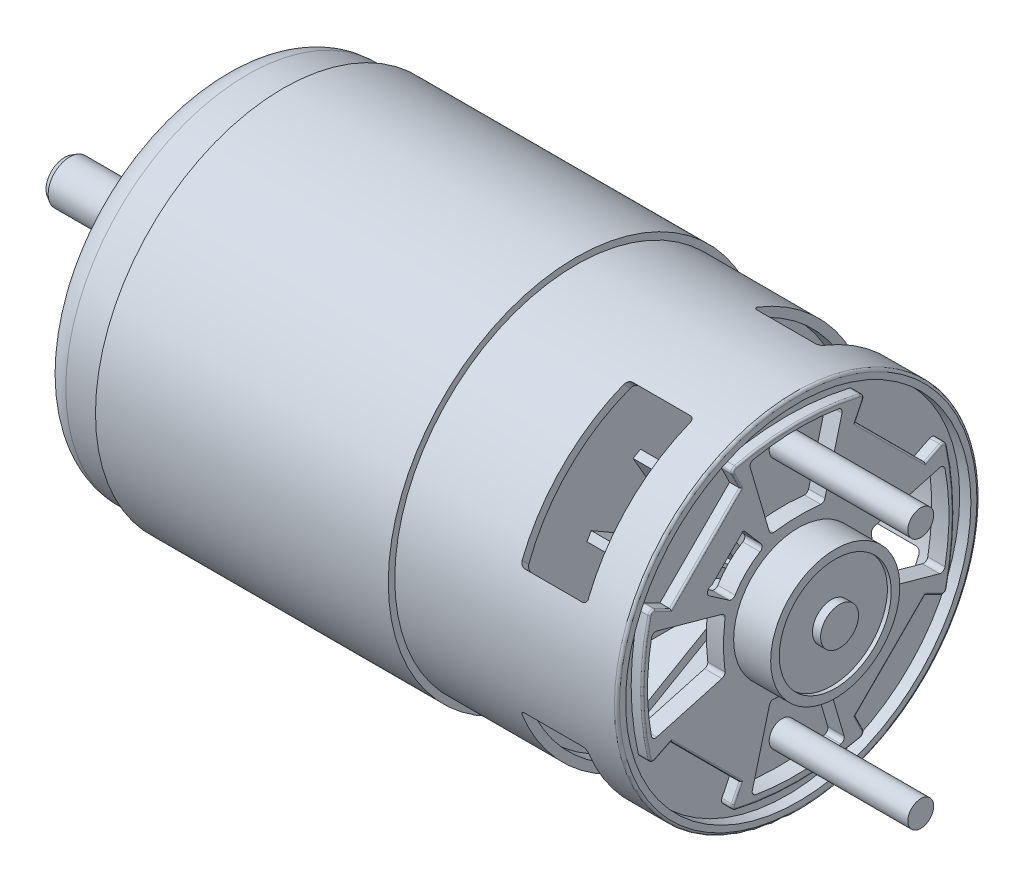
from build123d import *
from build123d.topology import SkipClean

# Parameters (mm, degrees)
CORTE_EXTRUS_O1_DEPTH                         = 89.581936213
CIRPATTERN1_COUNT                             = 3
CIRPATTERN1_ANGLE                             = 180
ESBO_O7_R                                     = 20.05
CORTE_EXTRUS_O3_DEPTH                         = 1.3
CORTE_EXTRUS_O5_DEPTH                         = 10
FILETE8_R                                     = 0.2
FILETE15_R                                    = 0.3
CORTE_EXTRUS_O8_START                         = -34
CORTE_EXTRUS_O8_DEPTH                         = 34
EXTRUS_O6_DEPTH                               = 15
CIRPATTERN11_COUNT                            = 12
ESBO_O30_R                                    = 1.5
ESPELHAR1_START                               = 61.780016501
ESPELHAR1_OUTLINE_R                           = 1.5
ESPELHAR1_DEPTH                               = 19.419252164
EXTRUS_O7_DEPTH                               = 0.1
CORTE_EXTRUS_O9_DEPTH                         = 2
FURO_ROSCADO_DE_M4X0_71_AT_2_COUNT            = 2
FURO_ROSCADO_DE_M4X0_71_AT_2_PITCH            = 29
BROCA_DE_ROSQUEAR_PARA_TARRAXA_DE_M1_21_D     = 0.95
BROCA_DE_ROSQUEAR_PARA_TARRAXA_DE_M1_21_DEPTH = 2.45
BROCA_DE_ROSQUEAR_PARA_TARRAXA_DE_M1_21_TIP   = 0.285408794


# Read off the part's stored shape, not the designer's step: Espelhar1
with BuildPart() as part:
    # Esboço1 → Revolução1 (revolve)
    with BuildSketch(Plane.XY, mode=Mode.PRIVATE) as revolu_o1_sk:
        with BuildLine():
            Line((0, 0), (35.65, 0))
            Line((35.65, 0), (52.7, 0))
            Line((52.7, 0), (52.7, -20.05))
            Line((52.7, -20.05), (65, -20.05))
            Line((65, -20.05), (65, -18.05))
            Line((65, -18.05), (65, -7))
            Line((65, -7), (67, -7))
            Line((67, -7), (70.35, -7))
            Line((70.35, -7), (70.35, -1.7))
            Line((70.35, -1.7), (70.8, -1.7))
            Line((70.8, -1.7), (70.8, 0))
            Line((70.8, 0), (71.8, 0))
            Line((71.8, 0), (71.8, -2.2))
            Line((71.8, -2.2), (70.85, -2.2))
            Line((70.85, -2.2), (70.85, -6.5))
            Line((70.85, -6.5), (71.3, -6.5))
            Line((71.3, -6.5), (71.3, -7.5))
            Line((71.3, -7.5), (67, -7.5))
            Line((67, -7.5), (67, -21.05))
            Line((67, -21.05), (41.2, -21.05))
            Line((41.2, -21.05), (41.2, -21.8))
            Line((41.2, -21.8), (7.2, -21.8))
            Line((7.2, -21.8), (7.2, -21.05))
            Line((7.2, -21.05), (3, -21.05))
            ThreePointArc((3, -21.05), (0.878679656, -20.171320344), (0, -18.05))
            Line((0, -18.05), (0, -7.5))
            Line((0, -7.5), (-0.891593319, -7.5))
            Line((-0.891593319, -7.5), (-0.891593319, -7))
            Line((-0.891593319, -7), (-0.991593319, -7))
            Line((-0.991593319, -7), (-0.991593319, -7.5))
            Line((-0.991593319, -7.5), (-2.746463407, -7.5))
            Line((-2.746463407, -7.5), (-4.4, -6.530087111))
            Line((-4.4, -6.530087111), (-4.4, -2.5))
            Line((-4.4, -2.5), (-17.595304543, -2.5))
            Line((-17.595304543, -2.5), (-18.2, -2.145304543))
            Line((-18.2, -2.145304543), (-18.2, 0))
            Line((-18.2, 0), (0, 0))
        make_face()
    revolve(revolu_o1_sk.sketch.rotate(Axis((0, 0, 0), (1, 0, 0)), 270), axis=Axis((0, 0, 0), (1, 0, 0)))

    # Esboço3 → Corte-extrusão1 (cut, through all)
    with BuildSketch(Plane(origin=(0, 14.884597744, 14.884597744), x_dir=(-1, 0, 0), z_dir=(0, -0.7071067811865464, -0.7071067811865488))):
        with BuildLine():
            Line((-55.00934782, 8.85), (-61.70934782, 8.85))
            ThreePointArc((-61.70934782, 8.85), (-62.062901211, 8.703553391), (-62.20934782, 8.35))
            Line((-62.20934782, 8.35), (-62.20934782, -8.35))
            ThreePointArc((-62.20934782, -8.35), (-62.062901211, -8.703553391), (-61.70934782, -8.85))
            Line((-61.70934782, -8.85), (-55.00934782, -8.85))
            ThreePointArc((-55.00934782, -8.85), (-54.65579443, -8.703553391), (-54.50934782, -8.35))
            Line((-54.50934782, -8.35), (-54.50934782, 8.35))
            ThreePointArc((-54.50934782, 8.35), (-54.65579443, 8.703553391), (-55.00934782, 8.85))
        make_face()
    corte_extrus_o1 = extrude(amount=CORTE_EXTRUS_O1_DEPTH, mode=Mode.SUBTRACT)

    # CirPattern1: Corte-extrusão1 ×3 about axis
    cirpattern1_axis = Axis((7.000357134, 0, 0), (-1, 0, 0))
    for i in range(1, CIRPATTERN1_COUNT):
        add(corte_extrus_o1.rotate(cirpattern1_axis, i * CIRPATTERN1_ANGLE / (CIRPATTERN1_COUNT - 1)), mode=Mode.SUBTRACT)

    # Esboço7 → Corte-extrusão3 (cut)
    with BuildSketch(Plane(origin=(67, 0, 0), x_dir=(0, 0, -1), z_dir=(1, 0, 0))):
        with Locations(Location((0, 0, 0), (0, 0, 180))):
            Circle(ESBO_O7_R)
        with BuildLine():
            Line((-14.759333209, 6.674989485), (-6.674989485, 14.759333209))
            Line((-6.674989485, 14.759333209), (-7.565857925, 16.564738995))
            ThreePointArc((-7.565857925, 16.564738995), (-7.569353151, 17.000014739), (-7.230365854, 17.273080302))
            ThreePointArc((-7.230365854, 17.273080302), (0, 18.1), (7.230365854, 17.273080302))
            ThreePointArc((7.230365854, 17.273080302), (7.569353151, 17.000014739), (7.565857925, 16.564738995))
            Line((7.565857925, 16.564738995), (6.675071889, 14.759500206))
            Line((6.675071889, 14.759500206), (14.759333209, 6.674989485))
            Line((14.759333209, 6.674989485), (16.564738995, 7.565857925))
            ThreePointArc((16.564738995, 7.565857925), (17.000014739, 7.569353151), (17.273080302, 7.230365854))
            ThreePointArc((17.273080302, 7.230365854), (18.067347739, 0), (17.273080302, -7.230365854))
            ThreePointArc((17.273080302, -7.230365854), (17.000014739, -7.569353151), (16.564738995, -7.565857925))
            Line((16.564738995, -7.565857925), (14.759333209, -6.674989485))
            Line((14.759333209, -6.674989485), (6.674989485, -14.759333209))
            Line((6.674989485, -14.759333209), (7.565857925, -16.564738995))
            ThreePointArc((7.565857925, -16.564738995), (7.569353151, -17.000014739), (7.230365854, -17.273080302))
            ThreePointArc((7.230365854, -17.273080302), (0, -18.1), (-7.230365854, -17.273080302))
            ThreePointArc((-7.230365854, -17.273080302), (-7.569353151, -17.000014739), (-7.565857925, -16.564738995))
            Line((-7.565857925, -16.564738995), (-6.674989485, -14.759333209))
            Line((-6.674989485, -14.759333209), (-14.759500206, -6.675071889))
            Line((-14.759500206, -6.675071889), (-16.564738995, -7.565857925))
            ThreePointArc((-16.564738995, -7.565857925), (-17.000014739, -7.569353151), (-17.273080302, -7.230365854))
            ThreePointArc((-17.273080302, -7.230365854), (-18.1, 0), (-17.273080302, 7.230365854))
            ThreePointArc((-17.273080302, 7.230365854), (-17.000014739, 7.569353151), (-16.564738995, 7.565857925))
            Line((-16.564738995, 7.565857925), (-14.759333209, 6.674989485))
        make_face(mode=Mode.SUBTRACT)
    extrude(amount=-CORTE_EXTRUS_O3_DEPTH, mode=Mode.SUBTRACT)

    # Esboço16 → Corte-extrusão5 (cut)
    with BuildSketch(Plane(origin=(71.3, 0, 0), x_dir=(0, 0, -1), z_dir=(1, 0, 0))):
        with BuildLine():
            Line((-8.866173575, 3.229311742), (-16.418045951, 5.327123206))
            ThreePointArc((-16.418045951, 5.327123206), (-16.816508393, 5.269591233), (-17.043399377, 4.937021349))
            ThreePointArc((-17.043399377, 4.937021349), (-17.499999601, -0.002446075), (-17.043399377, -4.941913499))
            ThreePointArc((-17.043399377, -4.941913499), (-16.816508393, -5.274483383), (-16.418045951, -5.332015356))
            Line((-16.418045951, -5.332015356), (-8.866173575, -3.234203892))
            ThreePointArc((-8.866173575, -3.234203892), (-8.601933644, -3.055007628), (-8.499999601, -2.752446075))
            ThreePointArc((-8.499999601, -2.752446075), (-8.673820343, -0.002446075), (-8.499999601, 2.747553925))
            ThreePointArc((-8.499999601, 2.747553925), (-8.601933644, 3.050115478), (-8.866173575, 3.229311742))
        make_face()
        with BuildLine():
            Line((-6.42222321, 10.345390234), (-10.068681178, 6.727572166))
            ThreePointArc((-10.068681178, 6.727572166), (-10.52515118, 6.365626727), (-10.329038386, 5.817074873))
            Line((-10.329038386, 5.817074873), (-8.042000968, 4.233624614))
            ThreePointArc((-8.042000968, 4.233624614), (-7.651753858, 4.155995501), (-7.328398427, 4.387858286))
            ThreePointArc((-7.328398427, 4.387858286), (-6.059999547, 6.019562221), (-4.436824226, 7.298857077))
            ThreePointArc((-4.436824226, 7.298857077), (-4.202746254, 7.647596124), (-4.317113937, 8.051738987))
            Line((-4.317113937, 8.051738987), (-6.144937732, 10.181562565))
            ThreePointArc((-6.144937732, 10.181562565), (-6.270028584, 10.28641356), (-6.42222321, 10.345390234))
        make_face()
        with BuildLine():
            ThreePointArc((2.624048817, 8.540510548), (2.925039994, 8.646992254), (3.100234135, 8.913902455))
            Line((3.100234135, 8.913902455), (5.084009802, 16.496528875))
            ThreePointArc((5.084009802, 16.496528875), (5.020480013, 16.894079139), (4.684528916, 17.115932934))
            ThreePointArc((4.684528916, 17.115932934), (-0.261258092, 17.498049498), (-5.193284271, 16.967069299))
            ThreePointArc((-5.193284271, 16.967069299), (-5.522397421, 16.73519265), (-5.573918513, 16.335908512))
            Line((-5.573918513, 16.335908512), (-3.362547627, 8.816505069))
            ThreePointArc((-3.362547627, 8.816505069), (-3.179389932, 8.554995412), (-2.875326709, 8.457632181))
            ThreePointArc((-2.875326709, 8.457632181), (-0.128258215, 8.672872371), (2.624048817, 8.540510548))
        make_face()
        with BuildLine():
            ThreePointArc((-2.871570193, -8.296691337), (-3.17256137, -8.403173043), (-3.347755512, -8.670083244))
            Line((-3.347755512, -8.670083244), (-5.331531178, -16.252709664))
            ThreePointArc((-5.331531178, -16.252709664), (-5.268001389, -16.650259927), (-4.932050292, -16.872113723))
            ThreePointArc((-4.932050292, -16.872113723), (0.013736716, -17.254230287), (4.945762895, -16.723250088))
            ThreePointArc((4.945762895, -16.723250088), (5.274876045, -16.491373439), (5.326397137, -16.092089301))
            Line((5.326397137, -16.092089301), (3.115026251, -8.572685858))
            ThreePointArc((3.115026251, -8.572685858), (2.931868556, -8.311176201), (2.627805333, -8.21381297))
            ThreePointArc((2.627805333, -8.21381297), (-0.119263161, -8.42905316), (-2.871570193, -8.296691337))
        make_face()
        with BuildLine():
            ThreePointArc((8.544372719, -2.958368741), (8.674599938, -3.132070968), (8.866173575, -3.234203892))
            Line((8.866173575, -3.234203892), (16.418045951, -5.332015356))
            ThreePointArc((16.418045951, -5.332015356), (16.816508393, -5.274483383), (17.043399377, -4.941913499))
            ThreePointArc((17.043399377, -4.941913499), (17.499999601, -0.002446075), (17.043399377, 4.937021349))
            ThreePointArc((17.043399377, 4.937021349), (16.816508393, 5.269591233), (16.418045951, 5.327123206))
            Line((16.418045951, 5.327123206), (8.866173575, 3.229311742))
            ThreePointArc((8.866173575, 3.229311742), (8.601933644, 3.050115478), (8.499999601, 2.747553925))
            ThreePointArc((8.499999601, 2.747553925), (8.673820343, -0.002446075), (8.499999601, -2.752446075))
            ThreePointArc((8.499999601, -2.752446075), (8.51121875, -2.857770714), (8.544372719, -2.958368741))
        make_face()
        with BuildLine():
            ThreePointArc((4.250268835, -7.017627412), (4.023304952, -7.344440021), (4.106805805, -7.733473045))
            Line((4.106805805, -7.733473045), (5.724539174, -9.996390105))
            ThreePointArc((5.724539174, -9.996390105), (6.275983928, -10.184214618), (6.631009819, -9.722342362))
            Line((6.631009819, -9.722342362), (10.193469393, -6.021782261))
            ThreePointArc((10.193469393, -6.021782261), (10.132206026, -5.870493622), (10.025481968, -5.746996951))
            Line((10.025481968, -5.746996951), (7.868357111, -3.951474561))
            ThreePointArc((7.868357111, -3.951474561), (7.462536752, -3.84320981), (7.117364574, -4.082516281))
            ThreePointArc((7.117364574, -4.082516281), (5.862674264, -5.724784736), (4.250268835, -7.017627412))
        make_face()
    extrude(amount=-CORTE_EXTRUS_O5_DEPTH, mode=Mode.SUBTRACT)

    # Filete8
    filete8_edges = [part.edges().sort_by_distance(p)[0] for p in [
        (67, -10.717161347, -10.717161347),
        (67, -7.120423705, -15.662036102),
        (67, -7.569353151, -17.000014739),
        (67, 0, -18.067347739),
        (67, 10.717244846, -10.717202549),
        (67, 17.000014739, -7.569353151),
        (67, 15.662036102, 7.120423705),
        (67, 7.569353151, 17.000014739),
        (67, 0, 18.1),
        (67, -7.120464907, 15.6621196),
        (67, -15.662036102, 7.120423705),
        (67, -17.000014739, 7.569353151),
        (67, -15.662036102, -7.120423705),
        (67, -17.000014739, -7.569353151),
        (67, -18.1, 0),
        (67, -10.717202549, 10.717244846),
        (67, -7.569353151, 17.000014739),
        (67, 7.120423705, 15.662036102),
        (67, 10.717161347, 10.717161347),
        (67, 17.000014739, 7.569353151),
        (67, 18.1, 0),
        (67, 15.6621196, -7.120464907),
        (67, 7.120423705, -15.662036102),
        (67, 7.569353151, -17.000014739),
    ]]
    fillet(filete8_edges, radius=FILETE8_R)

    # Filete15
    filete15_edges = [part.edges().sort_by_distance(p)[0] for p in [
        (67, 0, -21.05),
    ]]
    fillet(filete15_edges, radius=FILETE15_R)

    # Esboço24 → Corte-extrusão8 (cut)
    with SkipClean():  # the faces are left unmerged after this step: merging them gives an invalid solid
        with BuildSketch(Plane(origin=(41.2, 0, 0), x_dir=(0, 0, -1), z_dir=(1, 0, 0)).offset(CORTE_EXTRUS_O8_START)):
            with BuildLine():
                Line((16.307449364, -14.467449507), (15.776142554, -13.93613383))
                ThreePointArc((15.776142554, -13.93613383), (14.885364734, -14.883830714), (13.93775966, -15.774706199))
                Line((13.93775966, -15.774706199), (14.469062669, -16.306018076))
                ThreePointArc((14.469062669, -16.306018076), (15.41569028, -15.414165342), (16.307449364, -14.467449507))
            make_face()
        extrude(amount=CORTE_EXTRUS_O8_DEPTH, mode=Mode.SUBTRACT)

    # Esboço25 → Revolução2 (revolve)
    with SkipClean():  # the faces are left unmerged after this step: merging them gives an invalid solid
        with BuildSketch(Plane.XY, mode=Mode.PRIVATE) as revolu_o2_sk:
            Polygon((0, 0), (0, 2.789182723), (52.776438909, 2.789182723), (66.7, 2.789182723), (66.7, 0), align=None)
        revolve(revolu_o2_sk.sketch.rotate(Axis((66.7, 0, 0), (-1, 0, 0)), 90), axis=Axis((66.7, 0, 0), (-1, 0, 0)))

    # 3DSketch5 → Extrusão6 (add)
    with SkipClean():  # the faces are left unmerged after this step: merging them gives an invalid solid
        with BuildSketch(Plane(origin=(55.780016501, 0.527869154, 0.099588351), x_dir=(0.9863939238321437, -0.1643989873053574, 0), z_dir=(0, 0, -1))):
            Polygon((0, 0), (5.918363543, -0.986393924), (6.08276253, 0), (0.164398987, 0.986393924), align=None)
        extrus_o6 = extrude(amount=-EXTRUS_O6_DEPTH)

    # CirPattern11: Extrusão6 ×12 about axis
    with SkipClean():  # the faces are left unmerged after this step: merging them gives an invalid solid
        cirpattern11_axis = Axis((0, 0, 0), (1, 0, 0))
        for i in range(1, CIRPATTERN11_COUNT):
            add(extrus_o6.rotate(cirpattern11_axis, i * 360 / CIRPATTERN11_COUNT))

    # Varredura1: sweep along a path in Esboço29
    with SkipClean():  # the faces are left unmerged after this step: merging them gives an invalid solid
        with BuildLine(Plane(origin=(61.780016501, 15.099588351, 0.472130846), x_dir=(-1, 0, 0), z_dir=(0, 1, 0))) as varredura1_path:
            Line((0, -0.472130846), (-3.719983499, -0.472130846))
            Line((-3.719983499, -0.472130846), (-19.419252164, -0.472130846))
        # Esboço30 → Varredura1 (sweep)
        with BuildSketch(Plane(origin=(61.780016501, 0, 0), x_dir=(0, 0, -1), z_dir=(1, 0, 0))):
            with Locations((0.027869154, 15.099588351)):
                Circle(ESBO_O30_R)
        sweep(path=varredura1_path.line)

    # Espelhar1 outline → Espelhar1 (add)
    with SkipClean():  # the faces are left unmerged after this step: merging them gives an invalid solid
        with BuildSketch(Plane.YZ.offset(ESPELHAR1_START)):
            with Locations((-14.155326658, -0.027869154)):
                Circle(ESPELHAR1_OUTLINE_R)
        extrude(amount=ESPELHAR1_DEPTH)

    # Esboço32 → Extrusão7 (add)
    with SkipClean():  # the faces are left unmerged after this step: merging them gives an invalid solid
        with BuildSketch(Plane.ZY.offset(-65)):
            Polygon((3.383987702, 7.95282434), (-3.484611954, 7.95282434), (-6.038223157, 17.446425734), (1.791579617, 18.367927677), (6.979751516, 17.018543308), align=None)
            Polygon((4.385665567, -8.019241393), (-3.484611954, -8.019241393), (-6.038223157, -16.79213572), (1.122817683, -18.654640811), (5.994598808, -17.34421768), align=None)
        extrude(amount=-EXTRUS_O7_DEPTH)

    # Esboço34 → Corte-extrusão9 (cut)
    with SkipClean():  # the faces are left unmerged after this step: merging them gives an invalid solid
        with BuildSketch(Plane.ZY):
            with BuildLine():
                Line((-13.308160268, -5.825478376), (-10.535119022, -4.005629137))
                ThreePointArc((-10.535119022, -4.005629137), (-10.334590702, -3.744155671), (-10.34030391, -3.414690438))
                ThreePointArc((-10.34030391, -3.414690438), (-10.957351005, 0.043661018), (-10.34030391, 3.502012474))
                ThreePointArc((-10.34030391, 3.502012474), (-10.334590702, 3.831477708), (-10.535119022, 4.092951173))
                Line((-10.535119022, 4.092951173), (-13.308160268, 5.912800412))
                ThreePointArc((-13.308160268, 5.912800412), (-14.00207211, 5.980565725), (-14.451925973, 5.447895766))
                ThreePointArc((-14.451925973, 5.447895766), (-15.043029095, 0.043661018), (-14.451925973, -5.36057373))
                ThreePointArc((-14.451925973, -5.36057373), (-14.00207211, -5.893243689), (-13.308160268, -5.825478376))
            make_face()
            with BuildLine():
                Line((-4.092951173, 10.535119022), (-5.912800412, 13.308160268))
                ThreePointArc((-5.912800412, 13.308160268), (-5.980565725, 14.00207211), (-5.447895766, 14.451925973))
                ThreePointArc((-5.447895766, 14.451925973), (-0.043661018, 15.043029095), (5.36057373, 14.451925973))
                ThreePointArc((5.36057373, 14.451925973), (5.893243689, 14.00207211), (5.825478376, 13.308160268))
                Line((5.825478376, 13.308160268), (4.005629137, 10.535119022))
                ThreePointArc((4.005629137, 10.535119022), (3.744155671, 10.334590702), (3.414690438, 10.34030391))
                ThreePointArc((3.414690438, 10.34030391), (-0.043661018, 10.957351005), (-3.502012474, 10.34030391))
                ThreePointArc((-3.502012474, 10.34030391), (-3.831477708, 10.334590702), (-4.092951173, 10.535119022))
            make_face()
            with BuildLine():
                Line((13.308160268, 5.825478376), (10.535119022, 4.005629137))
                ThreePointArc((10.535119022, 4.005629137), (10.334590702, 3.744155671), (10.34030391, 3.414690438))
                ThreePointArc((10.34030391, 3.414690438), (10.957351005, -0.043661018), (10.34030391, -3.502012474))
                ThreePointArc((10.34030391, -3.502012474), (10.334590702, -3.831477708), (10.535119022, -4.092951173))
                Line((10.535119022, -4.092951173), (13.308160268, -5.912800412))
                ThreePointArc((13.308160268, -5.912800412), (14.00207211, -5.980565725), (14.451925973, -5.447895766))
                ThreePointArc((14.451925973, -5.447895766), (15.043029095, -0.043661018), (14.451925973, 5.36057373))
                ThreePointArc((14.451925973, 5.36057373), (14.00207211, 5.893243689), (13.308160268, 5.825478376))
            make_face()
            with BuildLine():
                Line((4.092951173, -10.535119022), (5.912800412, -13.308160268))
                ThreePointArc((5.912800412, -13.308160268), (5.980565725, -14.00207211), (5.447895766, -14.451925973))
                ThreePointArc((5.447895766, -14.451925973), (0.043661018, -15.043029095), (-5.36057373, -14.451925973))
                ThreePointArc((-5.36057373, -14.451925973), (-5.893243689, -14.00207211), (-5.825478376, -13.308160268))
                Line((-5.825478376, -13.308160268), (-4.005629137, -10.535119022))
                ThreePointArc((-4.005629137, -10.535119022), (-3.744155671, -10.334590702), (-3.414690438, -10.34030391))
                ThreePointArc((-3.414690438, -10.34030391), (0.043661018, -10.957351005), (3.502012474, -10.34030391))
                ThreePointArc((3.502012474, -10.34030391), (3.831477708, -10.334590702), (4.092951173, -10.535119022))
            make_face()
        extrude(amount=-CORTE_EXTRUS_O9_DEPTH, mode=Mode.SUBTRACT)

    # Esboço35 → Furo roscado de M4x0.71 (revolve, cut)
    with SkipClean():  # the faces are left unmerged after this step: merging them gives an invalid solid
        with BuildSketch(Plane(origin=(0, 10.253048327, -10.253048327), x_dir=(0, 0, 1), z_dir=(0, 1, 0))):
            Polygon((0, 0), (0, 5.991420021), (1.65, 5), (1.65, 8), (2, 8), (2, 0), align=None)
        furo_roscado_de_m4x0_71 = revolve(axis=Axis((-6.35, 10.253048327, -10.253048327), (1, 0, 0)), mode=Mode.SUBTRACT)

    # Furo roscado de M4x0.71 at 2: Furo roscado de M4x0.71 ×2
    with SkipClean():  # the faces are left unmerged after this step: merging them gives an invalid solid
        with Locations(*[Vector(0, -0.7003527014348834, 0.7137969554382122) * (i * FURO_ROSCADO_DE_M4X0_71_AT_2_PITCH) for i in range(1, FURO_ROSCADO_DE_M4X0_71_AT_2_COUNT)]):
            add(furo_roscado_de_m4x0_71, mode=Mode.SUBTRACT)

    # Broca de rosquear para tarraxa de M1.21
    with Locations(Plane(origin=(0, -7.375292462, -6.938123776), x_dir=(0, 0, -1), z_dir=(-1, 0, 0))):
        with Locations((0, 0)):
            Hole(BROCA_DE_ROSQUEAR_PARA_TARRAXA_DE_M1_21_D / 2, depth=BROCA_DE_ROSQUEAR_PARA_TARRAXA_DE_M1_21_DEPTH)
            with Locations((0, 0, -(BROCA_DE_ROSQUEAR_PARA_TARRAXA_DE_M1_21_DEPTH + BROCA_DE_ROSQUEAR_PARA_TARRAXA_DE_M1_21_TIP / 2))):  # 118° drill point
                Cone(0, BROCA_DE_ROSQUEAR_PARA_TARRAXA_DE_M1_21_D / 2, BROCA_DE_ROSQUEAR_PARA_TARRAXA_DE_M1_21_TIP, mode=Mode.SUBTRACT)


solid = part.part
